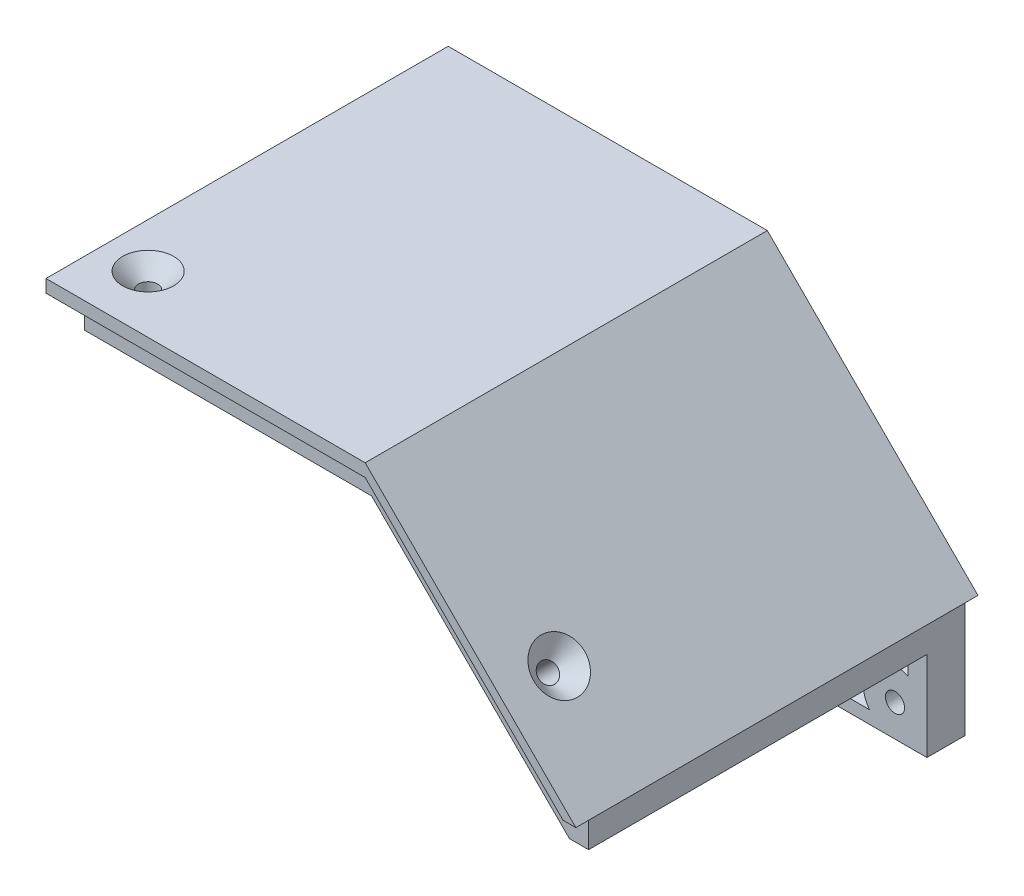
from build123d import *
from OCP.BRepFilletAPI import BRepFilletAPI_MakeChamfer
from build123d.topology import SkipClean

# Parameters (mm, degrees)
EXTRUDE_1_DEPTH          = 63
EXTRUDE_2_DEPTH          = 3
SKETCH_3_W               = 3
SKETCH_3_H               = 6
EXTRUDE_3_DEPTH          = 56
EXTRUDE_4_DEPTH          = 3
SKETCH_6_W               = 3
SKETCH_6_H               = 6
EXTRUDE_5_DEPTH          = 45
SKETCH_7_W               = 3
SKETCH_7_H               = 6
EXTRUDE_6_DEPTH          = 14
SKETCH_8_R               = 4
CUT_EXTRUDE_1_DEPTH      = 3
EXTRUDE_7_DEPTH          = 3
SKETCH_10_R              = 5
EXTRUDE_8_DEPTH          = 3
SKETCH_12_R              = 5
EXTRUDE_9_DEPTH          = 6
CUT_EXTRUDE_3_DEPTH      = 113.049096382
CUT_EXTRUDE_3_DEPTH_BACK = 113.049096382
SKETCH_13_R              = 1.5
CHAMFER_2_SIZE           = 2.5
SKETCH_14_R              = 5
EXTRUDE_10_DEPTH         = 6.363961031
CUT_EXTRUDE_4_DEPTH      = 106.959898075
CUT_EXTRUDE_4_DEPTH_BACK = 106.959898075
SKETCH_15_R              = 1.5
CHAMFER_3_SIZE           = 2.5
CUT_EXTRUDE_5_DEPTH      = 105.398275848
CUT_EXTRUDE_5_DEPTH_BACK = 105.398275848
SKETCH_11_R              = 1.5
CHAMFER_4_SIZE           = 3
CHAMFER_4_SIZE_2         = 3.575260778


with BuildPart() as part:
    # Эскиз1 → Бобышка-Вытянуть1 (new body)
    with BuildSketch(Plane.XY):
        Polygon((0, 0), (-31, 31), (-81, 31), (-81, 33), (-31, 33), (2, 0), align=None)
    extrude(amount=EXTRUDE_1_DEPTH)

    # Эскиз2 → Бобышка-Вытянуть2 (add)
    with BuildSketch(Plane(origin=(0, 0, 0), x_dir=(-1, 0, 0), z_dir=(0, 0, -1))):
        Polygon((0, 0), (31, 31), (79, 31), (79, -20), (0, -20), align=None)
    extrude(amount=-EXTRUDE_2_DEPTH)

    # Эскиз3 → Бобышка-Вытянуть3 (add)
    with BuildSketch(Plane.XY.offset(3)):
        Polygon((0, 0), (0, -6), (-3, -6), (-3, 3), align=None)
        with Locations((-77.5, 28)):
            Rectangle(SKETCH_3_W, SKETCH_3_H)
    extrude(amount=EXTRUDE_3_DEPTH)

    # Эскиз5 → Бобышка-Вытянуть4 (add)
    with BuildSketch(Plane.XY.offset(59)):
        Polygon((-79, 25), (-76, 25), (-34, 25), (-3, -6), (0, -6), (0, 0), (-31, 31), (-79, 31), align=None)
    extrude(amount=-EXTRUDE_4_DEPTH)

    # Эскиз6 → Бобышка-Вытянуть5 (add)
    with BuildSketch(Plane.XZ.offset(-25)):
        with Locations((-77.5, 3)):
            Rectangle(SKETCH_6_W, SKETCH_6_H)
    extrude(amount=EXTRUDE_5_DEPTH)

    # Эскиз7 → Бобышка-Вытянуть6 (add)
    with BuildSketch(Plane.XZ.offset(6)):
        with Locations((-1.5, 3)):
            Rectangle(SKETCH_7_W, SKETCH_7_H)
    extrude(amount=EXTRUDE_6_DEPTH)

    # Эскиз8 → Вырез-Вытянуть1 (cut)
    with BuildSketch(Plane(origin=(0, 0, 0), x_dir=(-1, 0, 0), z_dir=(0, 0, -1))):
        with Locations((39.5, -20)):
            Circle(SKETCH_8_R)
    extrude(amount=-CUT_EXTRUDE_1_DEPTH, mode=Mode.SUBTRACT)

    # Эскиз9 → Бобышка-Вытянуть7 (add)
    with SkipClean():  # the faces are left unmerged after this step: merging them gives an invalid solid
        with BuildSketch(Plane.XY.offset(3)):
            with BuildLine():
                Line((-3, -20), (-35.5, -20))
                ThreePointArc((-35.5, -20), (-39.5, -16), (-43.5, -20))
                Line((-43.5, -20), (-76, -20))
                Line((-76, -20), (-76, -18))
                Line((-76, -18), (-45.156854249, -18))
                ThreePointArc((-45.156854249, -18), (-39.5, -14), (-33.843145751, -18))
                Line((-33.843145751, -18), (-3, -18))
                Line((-3, -18), (-3, -20))
            make_face()
        extrude(amount=EXTRUDE_7_DEPTH)
    add(part.part.scale(1), mode=Mode.REPLACE)  # the faces are merged on a copy

    # Эскиз10 → Бобышка-Вытянуть8 (add)
    with BuildSketch(Plane.XY.offset(3)):
        with Locations((-74, -15)):
            Circle(SKETCH_10_R)
        with Locations((-5, -15)):
            Circle(SKETCH_10_R)
    extrude(amount=EXTRUDE_8_DEPTH)

    # Эскиз12 → Бобышка-Вытянуть9 (add)
    with BuildSketch(Plane.XZ.offset(-31)):
        with Locations((-74, 54)):
            Circle(SKETCH_12_R)
    extrude(amount=EXTRUDE_9_DEPTH)

    # Эскиз13 → Вырез-Вытянуть3 (cut, two sides: drawn at the far end of the back side and taken through both)
    with BuildSketch(Plane.XZ.offset(-25).offset(-CUT_EXTRUDE_3_DEPTH_BACK)):
        with Locations(Location((-74, 54, 0), (0, 0, 270))):
            Circle(SKETCH_13_R)
    extrude(amount=CUT_EXTRUDE_3_DEPTH + CUT_EXTRUDE_3_DEPTH_BACK, mode=Mode.SUBTRACT)

    # Фаска2
    chamfer_2_edges = [part.edges().sort_by_distance(p)[0] for p in [
        (-74, 33, 55.5),
    ]]
    chamfer(chamfer_2_edges, length=CHAMFER_2_SIZE)

    # Эскиз14 → Бобышка-Вытянуть10 (add)
    with BuildSketch(Plane(origin=(0, 0, 0), x_dir=(0, 0, 1), z_dir=(-0.7071067811865462, -0.7071067811865489, 0))):
        with Locations((54, 15)):
            Circle(SKETCH_14_R)
    extrude(amount=EXTRUDE_10_DEPTH)

    # Эскиз15 → Вырез-Вытянуть4 (cut, two sides: drawn at the far end of the back side and taken through both)
    with BuildSketch(Plane(origin=(-4.5, -4.5, 0), x_dir=(0, 0, 1), z_dir=(-0.7071067811865464, -0.7071067811865488, 0)).offset(-CUT_EXTRUDE_4_DEPTH_BACK)):
        with Locations(Location((54, 15, 0), (0, 0, 270))):
            Circle(SKETCH_15_R)
    extrude(amount=CUT_EXTRUDE_4_DEPTH + CUT_EXTRUDE_4_DEPTH_BACK, mode=Mode.SUBTRACT)

    # Фаска3
    chamfer_3_edges = [part.edges().sort_by_distance(p)[0] for p in [
        (-10.66726189, 12.66726189, 54),
    ]]
    chamfer(chamfer_3_edges, length=CHAMFER_3_SIZE)

    # Эскиз11 → Вырез-Вытянуть5 (cut, two sides: drawn at the far end of the back side and taken through both)
    with BuildSketch(Plane.XY.offset(6).offset(-CUT_EXTRUDE_5_DEPTH_BACK)):
        with Locations((-74, -15)):
            Circle(SKETCH_11_R)
        with Locations((-5, -15)):
            Circle(SKETCH_11_R)
    extrude(amount=CUT_EXTRUDE_5_DEPTH + CUT_EXTRUDE_5_DEPTH_BACK, mode=Mode.SUBTRACT)

    # Фаска4
    chamfer_4_edges_1 = [part.edges().sort_by_distance(p)[0] for p in [
        (-8.920951867, -11.897398437, 3),
    ]]
    chamfer_4_side_1 = [part.faces().sort_by_distance(p)[0] for p in [
        (-8.920951867, -11.897398437, 3.06),
    ]]
    chamfer_4_edges_2 = [part.edges().sort_by_distance(p)[0] for p in [
        (-70.079048133, -11.897398437, 3),
    ]]
    chamfer_4_side_2 = [part.faces().sort_by_distance(p)[0] for p in [
        (-70.079048133, -11.897398437, 3.06),
    ]]
    chamfer_4_edges_3 = [part.edges().sort_by_distance(p)[0] for p in [
        (-21.421572875, -18, 3),
    ]]
    chamfer_4_side_3 = [part.faces().sort_by_distance(p)[0] for p in [
        (-21.421572875, -18, 3.06),
    ]]
    chamfer_4_edges_4 = [part.edges().sort_by_distance(p)[0] for p in [
        (-39.5, -14, 3),
    ]]
    chamfer_4_side_4 = [part.faces().sort_by_distance(p)[0] for p in [
        (-39.5, -14, 3.06),
    ]]
    chamfer_4_edges_5 = [part.edges().sort_by_distance(p)[0] for p in [
        (-57.578427125, -18, 3),
    ]]
    chamfer_4_side_5 = [part.faces().sort_by_distance(p)[0] for p in [
        (-57.578427125, -18, 3.06),
    ]]
    chamfer_4 = BRepFilletAPI_MakeChamfer(part.part.solid().wrapped)
    for e in chamfer_4_edges_1:
        chamfer_4.Add(CHAMFER_4_SIZE - 0.0001, CHAMFER_4_SIZE_2 - 0.0001, e.wrapped, chamfer_4_side_1[0].wrapped)
    for e in chamfer_4_edges_2:
        chamfer_4.Add(CHAMFER_4_SIZE - 0.0001, CHAMFER_4_SIZE_2 - 0.0001, e.wrapped, chamfer_4_side_2[0].wrapped)
    for e in chamfer_4_edges_3:
        chamfer_4.Add(CHAMFER_4_SIZE - 0.0001, CHAMFER_4_SIZE_2 - 0.0001, e.wrapped, chamfer_4_side_3[0].wrapped)
    for e in chamfer_4_edges_4:
        chamfer_4.Add(CHAMFER_4_SIZE - 0.0001, CHAMFER_4_SIZE_2 - 0.0001, e.wrapped, chamfer_4_side_4[0].wrapped)
    for e in chamfer_4_edges_5:
        chamfer_4.Add(CHAMFER_4_SIZE - 0.0001, CHAMFER_4_SIZE_2 - 0.0001, e.wrapped, chamfer_4_side_5[0].wrapped)
    add(Compound.cast(chamfer_4.Shape()), mode=Mode.REPLACE)  # a hair under: the kernel refuses the full size


solid = part.part
